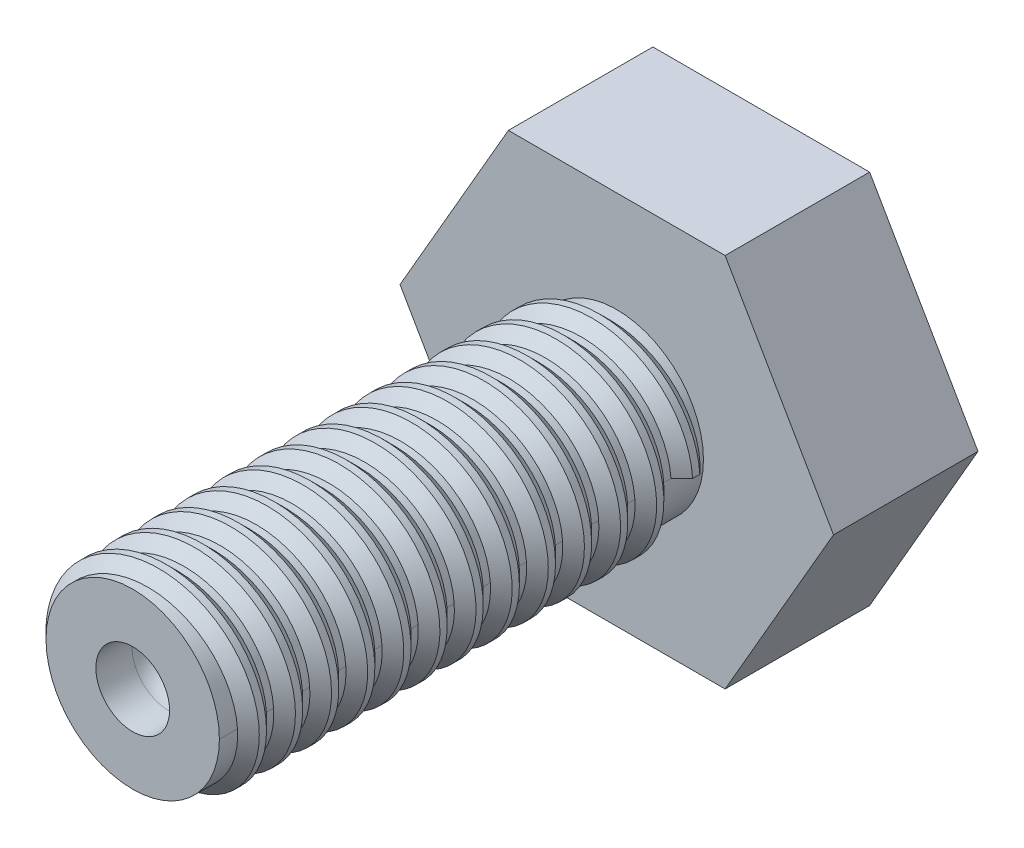
from build123d import *

# Parameters (mm, degrees)
EXTRUDE_1_DEPTH     = 10
SKETCH_2_R          = 6
EXTRUDE_2_DEPTH     = 33.5
SWEEP_1_PITCH       = 2.5
SKETCH_10_R         = 2.55
CUT_EXTRUDE_1_DEPTH = 2.5


with BuildPart() as part:
    # 草图1 → 凸台-拉伸1 (new body)
    with BuildSketch(Plane.XY):
        Polygon((15, 0), (7.5, 12.990381057), (-7.5, 12.990381057), (-15, 0), (-7.5, -12.990381057), (7.5, -12.990381057), align=None)
    extrude(amount=EXTRUDE_1_DEPTH)

    # 草图2 → 凸台-拉伸2 (add)
    with BuildSketch(Plane.XY.offset(10)):
        Circle(SKETCH_2_R)
    extrude(amount=EXTRUDE_2_DEPTH)

    # 扫描1: the profile of 草图4 profile screwed along a right-hand helix of 12.5 turns, 10 arcs to a turn; built about Z, then put on its axis
    sweep_1_z = Axis((0, 0, 0), (0, 0, 1))
    sweep_1_corners = [(5.9997, 0, -1.0003), (5.9997, 0, 1.0003), (6.75, 0, 0.25), (6.75, 0, -0.25)]
    with BuildLine(mode=Mode.PRIVATE) as sweep_1_profile:
        Line(sweep_1_corners[0], sweep_1_corners[1])
        Line(sweep_1_corners[1], sweep_1_corners[2])
        Line(sweep_1_corners[2], sweep_1_corners[3])
        Line(sweep_1_corners[3], sweep_1_corners[0])
    sweep_1_cap = Face(sweep_1_profile.wire())
    sweep_1_turn_angles = [0, 18, 36, 54, 72, 90, 108, 126, 144, 162, 180, 198, 216, 234, 252, 270, 288, 306, 324, 342, 360]
    sweep_1_turn_weights = [1, 0.9510565162951535, 1, 0.9510565162951535, 1, 0.9510565162951535, 1, 0.9510565162951535, 1, 0.9510565162951535, 1, 0.9510565162951535, 1, 0.9510565162951535, 1, 0.9510565162951535, 1, 0.9510565162951535, 1, 0.9510565162951535, 1]
    sweep_1_turn_rails = [Edge.make_bspline([Vector(p[0], p[1], 0).rotate(sweep_1_z, sweep_1_turn_angles[k]) / sweep_1_turn_weights[k] + Vector(0, 0, p[2] + SWEEP_1_PITCH * sweep_1_turn_angles[k] / 360) for k in range(21)], [0, 0, 0, 1, 1, 2, 2, 3, 3, 4, 4, 5, 5, 6, 6, 7, 7, 8, 8, 9, 9, 10, 10, 10], 2, sweep_1_turn_weights) for p in sweep_1_corners]
    sweep_1_turn_sides = [Face.make_surface_from_curves(sweep_1_turn_rails[p[0]], sweep_1_turn_rails[p[1]]) for p in [(0, 1), (1, 2), (2, 3), (3, 0)]]
    sweep_1_last_angles = [4320, 4338, 4356, 4374, 4392, 4410, 4428, 4446, 4464, 4482, 4500]
    sweep_1_last_weights = [1, 0.9510565162951535, 1, 0.9510565162951535, 1, 0.9510565162951535, 1, 0.9510565162951535, 1, 0.9510565162951315, 1]
    sweep_1_last_rails = [Edge.make_bspline([Vector(p[0], p[1], 0).rotate(sweep_1_z, sweep_1_last_angles[k]) / sweep_1_last_weights[k] + Vector(0, 0, p[2] + SWEEP_1_PITCH * sweep_1_last_angles[k] / 360) for k in range(11)], [0, 0, 0, 1, 1, 2, 2, 3, 3, 4, 4, 5, 5, 5], 2, sweep_1_last_weights) for p in sweep_1_corners]
    sweep_1_last_sides = [Face.make_surface_from_curves(sweep_1_last_rails[p[0]], sweep_1_last_rails[p[1]]) for p in [(0, 1), (1, 2), (2, 3), (3, 0)]]
    sweep_1 = Plane(origin=(0, 0, 11.25), x_dir=(1, 0, 0), z_dir=(0, 0, 1)) * Solid(Shell([*[p.moved(Location((0, 0, SWEEP_1_PITCH * i))) for i in range(12) for p in sweep_1_turn_sides], *sweep_1_last_sides, sweep_1_cap, sweep_1_cap.rotate(sweep_1_z, 4500).moved(Location((0, 0, SWEEP_1_PITCH * 4500 / 360)))]))
    add(sweep_1)

    # 草图10 → 切除-拉伸1 (cut)
    with BuildSketch(Plane.XY.offset(43.5)):
        Circle(SKETCH_10_R)
    extrude(amount=-CUT_EXTRUDE_1_DEPTH, mode=Mode.SUBTRACT)

    # 草图11 → 切除-旋转1 (revolve, cut)
    with BuildSketch(Plane.XY.offset(41)):
        with BuildLine():
            Line((0, 2.55), (0, -2.55))
            ThreePointArc((0, -2.55), (2.55, 0), (0, 2.55))
        make_face()
    revolve(axis=Axis((0, 2.55, 41), (0, -1, 0)), mode=Mode.SUBTRACT)


solid = part.part
